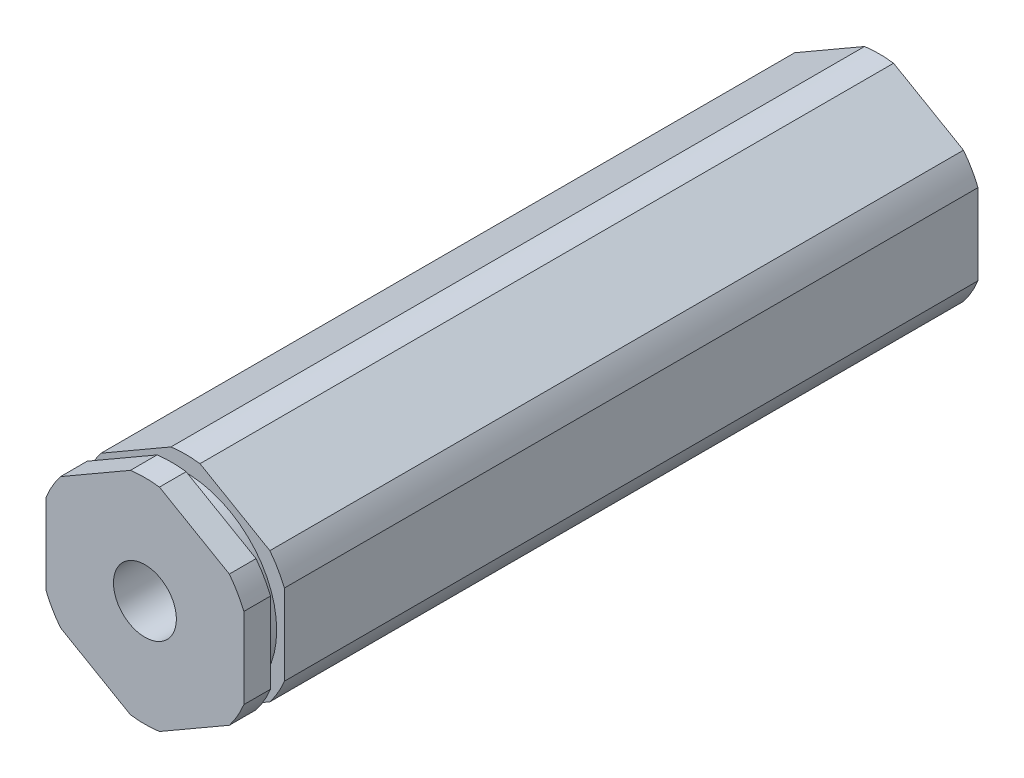
from build123d import *

# Parameters (mm, degrees)
BOSS_EXTRUDE1_DEPTH                  = 23.56485
F_10_32_TAPPED_HOLE1_D               = 4.0386
F_10_32_TAPPED_HOLE1_DEPTH           = 16.34744
F_10_32_TAPPED_HOLE1_TIP             = 1.213317848
F_10_32_TAPPED_HOLE1_ON_FACE_2_D     = 4.0386
F_10_32_TAPPED_HOLE1_ON_FACE_2_DEPTH = 16.34744
F_10_32_TAPPED_HOLE1_ON_FACE_2_TIP   = 1.213317848
SKETCH5_W                            = 0.889
SKETCH5_H                            = 1.0033


with BuildPart() as part:
    # Sketch1 → Boss-Extrude1 (new, symmetric)
    with BuildSketch(Plane.XY):
        with BuildLine():
            ThreePointArc((0.93173274, 6.79441227), (0, 6.858), (-0.93173274, 6.79441227))
            Line((-0.93173274, 6.79441227), (-5.41826726, 4.204110358))
            ThreePointArc((-5.41826726, 4.204110358), (-5.939202219, 3.429), (-6.35, 2.590301913))
            Line((-6.35, 2.590301913), (-6.35, -2.590301913))
            ThreePointArc((-6.35, -2.590301913), (-5.939202219, -3.429), (-5.41826726, -4.204110358))
            Line((-5.41826726, -4.204110358), (-0.93173274, -6.79441227))
            ThreePointArc((-0.93173274, -6.79441227), (0, -6.858), (0.93173274, -6.79441227))
            Line((0.93173274, -6.79441227), (5.41826726, -4.204110358))
            ThreePointArc((5.41826726, -4.204110358), (5.939202219, -3.429), (6.35, -2.590301913))
            Line((6.35, -2.590301913), (6.35, 2.590301913))
            ThreePointArc((6.35, 2.590301913), (5.939202219, 3.429), (5.41826726, 4.204110358))
            Line((5.41826726, 4.204110358), (0.93173274, 6.79441227))
        make_face()
    extrude(amount=BOSS_EXTRUDE1_DEPTH, both=True)

    # #10-32 Tapped Hole1
    with Locations(Plane.XY.offset(23.56485)):
        with Locations((0, 0)):
            Hole(F_10_32_TAPPED_HOLE1_D / 2, depth=F_10_32_TAPPED_HOLE1_DEPTH)
            with Locations((0, 0, -(F_10_32_TAPPED_HOLE1_DEPTH + F_10_32_TAPPED_HOLE1_TIP / 2))):  # 118° drill point
                Cone(0, F_10_32_TAPPED_HOLE1_D / 2, F_10_32_TAPPED_HOLE1_TIP, mode=Mode.SUBTRACT)

    # #10-32 Tapped Hole1 on face 2
    with Locations(Plane(origin=(0, 0, -23.56485), x_dir=(-1, 0, 0), z_dir=(0, 0, -1))):
        with Locations((0, 0)):
            Hole(F_10_32_TAPPED_HOLE1_ON_FACE_2_D / 2, depth=F_10_32_TAPPED_HOLE1_ON_FACE_2_DEPTH)
            with Locations((0, 0, -(F_10_32_TAPPED_HOLE1_ON_FACE_2_DEPTH + F_10_32_TAPPED_HOLE1_ON_FACE_2_TIP / 2))):  # 118° drill point
                Cone(0, F_10_32_TAPPED_HOLE1_ON_FACE_2_D / 2, F_10_32_TAPPED_HOLE1_ON_FACE_2_TIP, mode=Mode.SUBTRACT)

    # Sketch5 → Cut-Revolve1 (revolve, cut)
    with BuildSketch(Plane(origin=(0, 0, 0), x_dir=(0, 0, -1), z_dir=(1, 0, 0))):
        with Locations((-21.40585, 6.35635)):
            Rectangle(SKETCH5_W, SKETCH5_H)
    revolve(axis=Axis((0, 0, 165.047176272), (0, 0, -1)), mode=Mode.SUBTRACT)


solid = part.part
